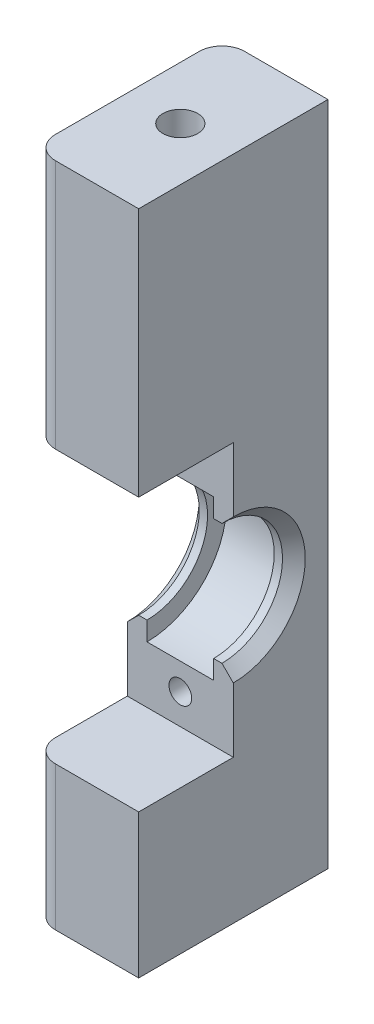
from build123d import *

# Parameters (mm, degrees)
SKETCH_1_W                  = 7
SKETCH_1_H                  = 44
EXTRUDE_485_DEPTH           = 12.5
FILLET_3_R                  = 1.5
CUT_EXTRUDE_1218_REACH      = 28.254
SKETCH_6_R                  = 4
CUT_EXTRUDE_1261_REACH      = 28.254
SKETCH_7_W                  = 6.25
SKETCH_7_H                  = 18
SKETCH_11_R                 = 1.15
CUT_EXTRUDE_1309_DEPTH      = 8
CUT_EXTRUDE_1453_DEPTH      = 2.2
CUT_EXTRUDE_1453_DEPTH_BACK = 2.2
SKETCH_12_R                 = 5.25
SKETCH_13_R                 = 0.75
CUT_EXTRUDE_1751_DEPTH      = 5.5
CHAMFER_1_SIZE              = 0.75


with BuildPart() as part:
    # Эскиз1 → Extrude 485 (new body)
    with BuildSketch(Plane.XY):
        Rectangle(SKETCH_1_W, SKETCH_1_H)
    extrude(amount=EXTRUDE_485_DEPTH)

    # Скругление3
    fillet_3_edges = [part.edges().sort_by_distance(p)[0] for p in [
        (-3.5, 0, 12.5),
        (-3.5, 0, 0),
    ]]
    fillet(fillet_3_edges, radius=FILLET_3_R)

    # Эскиз6 → Cut-Extrude 1218 (cut, up to next)
    with BuildSketch(Plane.ZY.offset(3.5), mode=Mode.PRIVATE) as cut_extrude_1218_sk1:
        with Locations((6.25, -3.5)):
            Circle(SKETCH_6_R)
    cut_extrude_1218_tool1 = extrude(cut_extrude_1218_sk1.sketch, amount=-CUT_EXTRUDE_1218_REACH, mode=Mode.PRIVATE) & part.part
    add(cut_extrude_1218_tool1.solids().sort_by_distance((-3.5, -3.5, 6.25))[0], mode=Mode.SUBTRACT)

    # Эскиз7 → Cut-Extrude 1261 (cut, up to next)
    with BuildSketch(Plane.ZY.offset(3.5), mode=Mode.PRIVATE) as cut_extrude_1261_sk1:
        with Locations((9.375, -3.5)):
            Rectangle(SKETCH_7_W, SKETCH_7_H)
    cut_extrude_1261_tool1 = extrude(cut_extrude_1261_sk1.sketch, amount=-CUT_EXTRUDE_1261_REACH, mode=Mode.PRIVATE) & part.part
    add(cut_extrude_1261_tool1.solids().sort_by_distance((-3.5, -3.5, 9.375))[0], mode=Mode.SUBTRACT)

    # Эскиз11 → Cut-Extrude 1309 (cut)
    with BuildSketch(Plane.XZ.offset(22)):
        with Locations(Location((0, 6.25, 0), (0, 0, 270))):
            Circle(SKETCH_11_R)
    cut_extrude_1309 = extrude(amount=-CUT_EXTRUDE_1309_DEPTH, mode=Mode.SUBTRACT)

    # Mirror 1353: Cut-Extrude 1309 across plane
    add(cut_extrude_1309.mirror(Plane.ZX), mode=Mode.SUBTRACT)

    # Эскиз12 → Cut-Extrude 1453 (cut, two sides: drawn at the far end of the back side and taken through both)
    with BuildSketch(Plane(origin=(0, 0, 0), x_dir=(0, 0, -1), z_dir=(1, 0, 0)).offset(-CUT_EXTRUDE_1453_DEPTH_BACK)):
        with Locations((-6.25, -3.5)):
            Circle(SKETCH_12_R)
    extrude(amount=CUT_EXTRUDE_1453_DEPTH + CUT_EXTRUDE_1453_DEPTH_BACK, mode=Mode.SUBTRACT)

    # Эскиз13 → Cut-Extrude 1751 (cut)
    with BuildSketch(Plane.XY.offset(6.25)):
        with Locations((0, 3.5)):
            Circle(SKETCH_13_R)
        with Locations((0, -10.5)):
            Circle(SKETCH_13_R)
    extrude(amount=-CUT_EXTRUDE_1751_DEPTH, mode=Mode.SUBTRACT)

    # Фаска1
    chamfer_1_edges = [part.edges().sort_by_distance(p)[0] for p in [
        (-3.5, -3.5, 2.25),
        (3.5, -3.5, 2.25),
    ]]
    chamfer(chamfer_1_edges, length=CHAMFER_1_SIZE - 0.0001)  # a hair under: the kernel refuses the full size


solid = part.part
